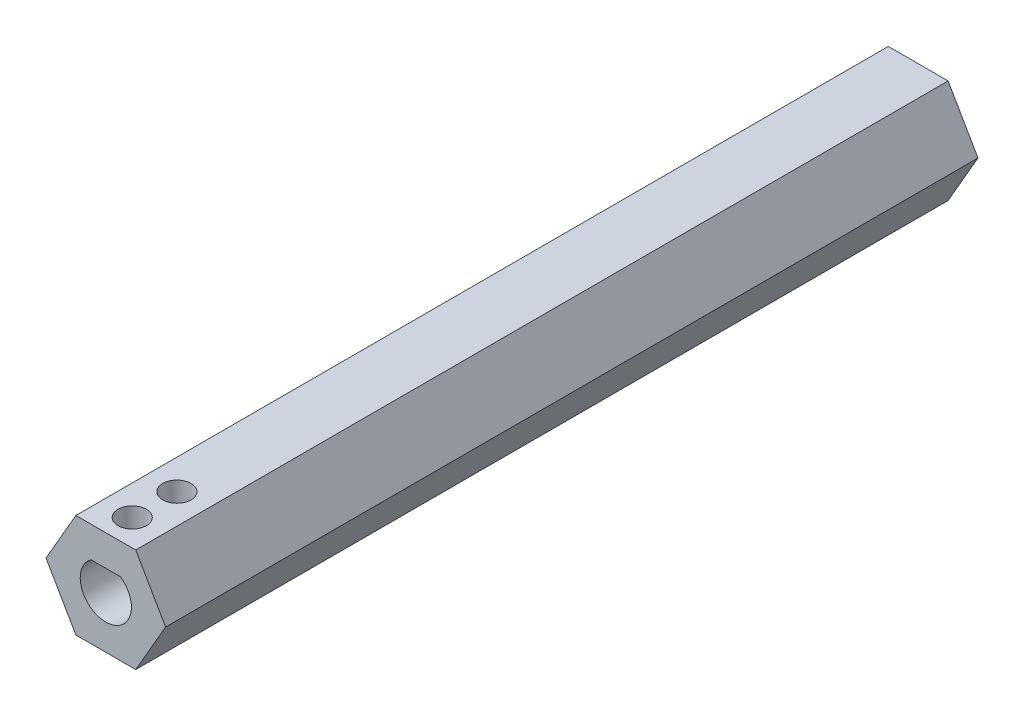
from build123d import *

# Parameters (mm, degrees)
SALIENTE_EXTRUIR1_DEPTH = 100
CROQUIS2_R              = 1.75
CORTAR_EXTRUIR1_DEPTH   = 7.5


with BuildPart() as part:
    # Croquis1 → Saliente-Extruir1 (new body)
    with BuildSketch(Plane.XY):
        Polygon((7.361677812, 0), (3.680838906, 6.3754), (-3.680838906, 6.3754), (-7.361677812, 0), (-3.680838906, -6.3754), (3.680838906, -6.3754), align=None)
        with BuildLine():
            Line((-1.8, 2.585053191), (1.8, 2.585053191))
            ThreePointArc((1.8, 2.585053191), (0, -3.15), (-1.8, 2.585053191))
        make_face(mode=Mode.SUBTRACT)
    extrude(amount=SALIENTE_EXTRUIR1_DEPTH)

    # Croquis2 → Cortar-Extruir1 (cut)
    with BuildSketch(Plane(origin=(0, 6.3754, 0), x_dir=(1, 0, 0), z_dir=(0, 1, 0))):
        with Locations((0, -96.75)):
            Circle(CROQUIS2_R)
        with Locations((0, -91.25)):
            Circle(CROQUIS2_R)
    extrude(amount=-CORTAR_EXTRUIR1_DEPTH, mode=Mode.SUBTRACT)


solid = part.part
